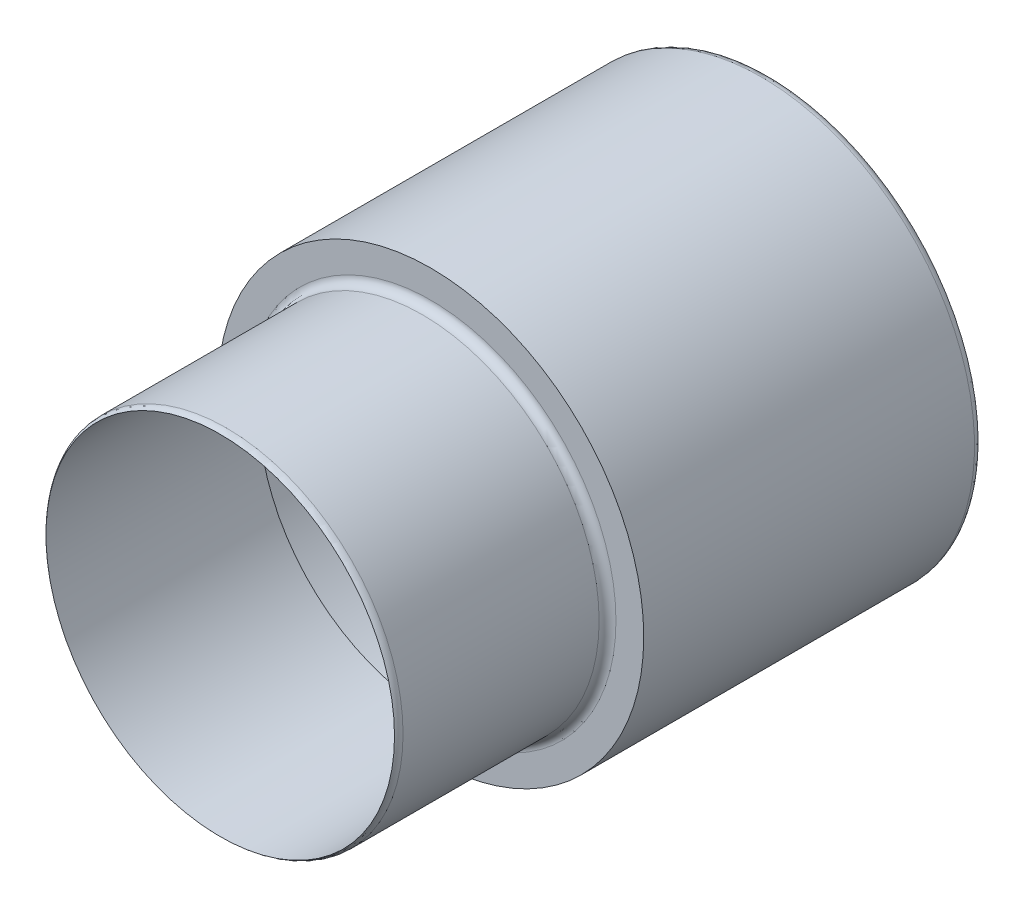
from build123d import *

# Parameters (mm, degrees)
SKETCH1_R           = 253
BOSS_EXTRUDE1_DEPTH = 400
SKETCH2_R           = 210
BOSS_EXTRUDE2_DEPTH = 250
SHELL1_T            = -3
FILLET1_R           = 10


with BuildPart() as part:
    # Sketch1 → Boss-Extrude1 (new body)
    with BuildSketch(Plane.XY):
        Circle(SKETCH1_R)
    extrude(amount=BOSS_EXTRUDE1_DEPTH)

    # Sketch2 → Boss-Extrude2 (add)
    with BuildSketch(Plane.XY.offset(400)):
        Circle(SKETCH2_R)
    extrude(amount=BOSS_EXTRUDE2_DEPTH)

    # Shell1
    shell1_openings = [part.faces().sort_by_distance(p)[0] for p in [
        (0, 0, 0),
        (0, 0, 650),
    ]]
    offset(amount=SHELL1_T, openings=shell1_openings, kind=Kind.INTERSECTION)

    # Fillet1
    # the kernel refuses this fillet: 10 mm, written as the material it adds along each edge
    with BuildSketch(Plane(origin=(0, 0, 400), x_dir=(1, 0, 0), z_dir=(0, -1, 0))) as fillet1_piece_1:
        with BuildLine():
            CenterArc((210 + FILLET1_R, FILLET1_R), FILLET1_R, 180, 90)
            Line((210, FILLET1_R), (210, 0))
            Line((210, 0), (210 + FILLET1_R, 0))
        make_face()
    revolve(axis=Axis((0, 0, 400), (0, 0, 1)))
    # the kernel refuses this fillet: 10 mm, written as the material it takes off along each edge
    with BuildSketch(Plane(origin=(0, 0, 0), x_dir=(1, 0, 0), z_dir=(0, -1, 0))) as fillet1_2_piece_1:
        with BuildLine():
            CenterArc((243, 7.141428429), FILLET1_R, 314.427004001, 45.572995999)
            Line((250, 0), (253, 0))
            Line((253, 0), (253, 7.141428429))
        make_face()
    revolve(axis=Axis((0, 0, 0), (0, 0, 1)), mode=Mode.SUBTRACT)
    with BuildSketch(Plane(origin=(0, 0, 650), x_dir=(1, 0, 0), z_dir=(0, -1, 0))) as fillet1_2_piece_2:
        with BuildLine():
            CenterArc((200, -7.141428429), FILLET1_R, 0, 45.572995999)
            Line((207, 0), (210, 0))
            Line((210, 0), (210, -7.141428429))
        make_face()
    revolve(axis=Axis((0, 0, 650), (0, 0, 1)), mode=Mode.SUBTRACT)


solid = part.part
